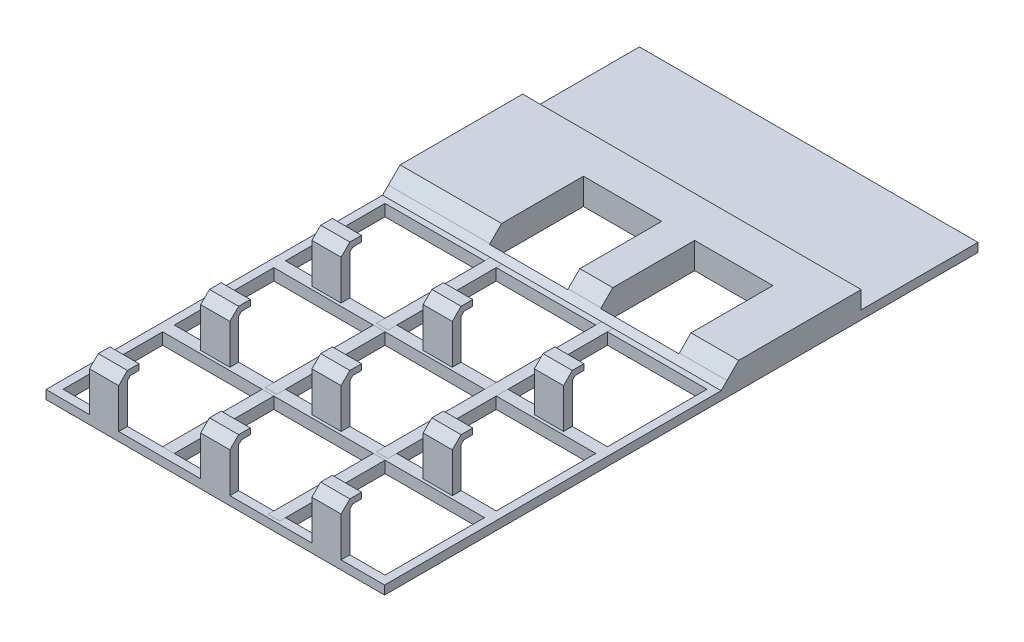
from build123d import *

# Parameters (mm, degrees)
SKETCH1_W             = 2
SKETCH1_H             = 57.15
EXTRUDE_THIN1_DEPTH   = 2
SKETCH1_W_2           = 59.15
SKETCH1_H_2           = 59.15
SKETCH1_W_3           = 55.15
SKETCH1_H_3           = 55.15
EXTRUDE_THIN1_2_DEPTH = 2
EXTRUDE_THIN1_3_DEPTH = 2
SKETCH1_W_4           = 57.15
SKETCH1_H_4           = 2
EXTRUDE_THIN1_4_DEPTH = 2
EXTRUDE_THIN1_5_DEPTH = 2
BOSS_EXTRUDE1_START   = 2
SKETCH2_W             = 5
SKETCH2_H             = 1.5
BOSS_EXTRUDE1_DEPTH   = 7.3
BOSS_EXTRUDE2_START   = 9.3
SKETCH3_W             = 5
SKETCH3_H             = 3.5
BOSS_EXTRUDE2_DEPTH   = 1
CHAMFER1_SIZE         = 0.5
CHAMFER2_SIZE         = 1.5
SKETCH4_W             = 58
SKETCH4_H             = 43
BOSS_EXTRUDE3_DEPTH   = 5
CHAMFER3_SIZE         = 2
SKETCH5_W             = 13.4
SKETCH5_H             = 16.1
CUT_EXTRUDE1_DEPTH    = 83.879038363
CHAMFER4_START        = -0.425
CHAMFER4_DEPTH        = 58.575
CHAMFER4_2_DEPTH      = 17.39
CHAMFER4_START_2      = 49.415
CHAMFER4_3_DEPTH      = 8.735
CHAMFER4_START_3      = 30.365
CHAMFER4_4_DEPTH      = 5.65
CUT_EXTRUDE2_START    = 5
SKETCH6_W             = 58
SKETCH6_H             = 20
CUT_EXTRUDE2_DEPTH    = 3
CUT_EXTRUDE3_DEPTH    = 83.879038363
CHAMFER5_SIZE         = 0.5


with BuildPart() as part:
    # Sketch1 → Extrude-Thin1 (new body)
    with BuildSketch(Plane(origin=(0, 0, 0), x_dir=(1, 0, 0), z_dir=(0, 1, 0))):
        with Locations((38.1, -28.575)):
            Rectangle(SKETCH1_W, SKETCH1_H)
    extrude(amount=EXTRUDE_THIN1_DEPTH)


with BuildPart() as body_2:
    # Sketch1 → Extrude-Thin1 2 (new body)
    with BuildSketch(Plane(origin=(0, 0, 0), x_dir=(1, 0, 0), z_dir=(0, 1, 0))):
        with Locations((28.575, -28.575)):
            Rectangle(SKETCH1_W_2, SKETCH1_H_2)
        with Locations((28.575, -28.575)):
            Rectangle(SKETCH1_W_3, SKETCH1_H_3, mode=Mode.SUBTRACT)
    extrude(amount=EXTRUDE_THIN1_2_DEPTH)



with BuildPart() as body_3:
    # Sketch1 → Extrude-Thin1 3 (new body)
    with BuildSketch(Plane(origin=(0, 0, 0), x_dir=(1, 0, 0), z_dir=(0, 1, 0))):
        with Locations((19.05, -28.575)):
            Rectangle(SKETCH1_W, SKETCH1_H)
    extrude(amount=EXTRUDE_THIN1_3_DEPTH)


with BuildPart() as body_4:
    # Sketch1 → Extrude-Thin1 4 (new body)
    with BuildSketch(Plane(origin=(0, 0, 0), x_dir=(1, 0, 0), z_dir=(0, 1, 0))):
        with Locations((28.575, -38.1)):
            Rectangle(SKETCH1_W_4, SKETCH1_H_4)
    extrude(amount=EXTRUDE_THIN1_4_DEPTH)


with BuildPart() as body_5:
    # Sketch1 → Extrude-Thin1 5 (new body)
    with BuildSketch(Plane(origin=(0, 0, 0), x_dir=(1, 0, 0), z_dir=(0, 1, 0))):
        with Locations((28.575, -19.05)):
            Rectangle(SKETCH1_W_4, SKETCH1_H_4)
    extrude(amount=EXTRUDE_THIN1_5_DEPTH)


with BuildPart() as body_2_1:
    add(body_2.part)

    add(body_4.part)  # Boss-Extrude1 merges body 4

    add(body_5.part)  # Boss-Extrude1 merges body 5
    # Sketch2 → Boss-Extrude1 (add)
    with BuildSketch(Plane(origin=(0, 0, 0), x_dir=(1, 0, 0), z_dir=(0, 1, 0)).offset(BOSS_EXTRUDE1_START)):
        with Locations((28.575, -56.9)):
            Rectangle(SKETCH2_W, SKETCH2_H)
        with Locations((9.525, -56.9)):
            Rectangle(SKETCH2_W, SKETCH2_H)
        with Locations((47.625, -56.9)):
            Rectangle(SKETCH2_W, SKETCH2_H)
        with Locations((28.575, -37.85)):
            Rectangle(SKETCH2_W, SKETCH2_H)
        with Locations((47.625, -37.85)):
            Rectangle(SKETCH2_W, SKETCH2_H)
        with Locations((28.575, -18.8)):
            Rectangle(SKETCH2_W, SKETCH2_H)
        with Locations((47.625, -18.8)):
            Rectangle(SKETCH2_W, SKETCH2_H)
        with Locations((9.525, -37.85)):
            Rectangle(SKETCH2_W, SKETCH2_H)
        with Locations((9.525, -18.8)):
            Rectangle(SKETCH2_W, SKETCH2_H)
    extrude(amount=BOSS_EXTRUDE1_DEPTH)

    # Sketch3 → Boss-Extrude2 (add)
    with BuildSketch(Plane(origin=(0, 0, 0), x_dir=(1, 0, 0), z_dir=(0, 1, 0)).offset(BOSS_EXTRUDE2_START)):
        with Locations((28.575, -55.9)):
            Rectangle(SKETCH3_W, SKETCH3_H)
        with Locations((9.525, -55.9)):
            Rectangle(SKETCH3_W, SKETCH3_H)
        with Locations((47.625, -55.9)):
            Rectangle(SKETCH3_W, SKETCH3_H)
        with Locations((28.575, -36.85)):
            Rectangle(SKETCH3_W, SKETCH3_H)
        with Locations((47.625, -36.85)):
            Rectangle(SKETCH3_W, SKETCH3_H)
        with Locations((28.575, -17.8)):
            Rectangle(SKETCH3_W, SKETCH3_H)
        with Locations((47.625, -17.8)):
            Rectangle(SKETCH3_W, SKETCH3_H)
        with Locations((9.525, -36.85)):
            Rectangle(SKETCH3_W, SKETCH3_H)
        with Locations((9.525, -17.8)):
            Rectangle(SKETCH3_W, SKETCH3_H)
    extrude(amount=BOSS_EXTRUDE2_DEPTH)

    # Chamfer1
    chamfer1_edges = [body_2_1.edges().sort_by_distance(p)[0] for p in [
        (28.575, 9.3, 56.15),
        (47.625, 9.3, 56.15),
        (47.625, 9.3, 37.1),
        (28.575, 9.3, 18.05),
        (47.625, 9.3, 18.05),
        (9.525, 9.3, 37.1),
        (28.575, 9.3, 37.1),
        (9.525, 9.3, 18.05),
        (9.525, 9.3, 56.15),
    ]]
    chamfer(chamfer1_edges, length=CHAMFER1_SIZE)

    # Chamfer2
    chamfer2_edges = [body_2_1.edges().sort_by_distance(p)[0] for p in [
        (28.575, 10.3, 57.65),
        (47.625, 10.3, 57.65),
        (28.575, 10.3, 38.6),
        (47.625, 10.3, 38.6),
        (28.575, 10.3, 19.55),
        (47.625, 10.3, 19.55),
        (9.525, 10.3, 38.6),
        (9.525, 10.3, 19.55),
        (9.525, 10.3, 57.65),
    ]]
    chamfer(chamfer2_edges, length=CHAMFER2_SIZE)

    # Sketch4 → Boss-Extrude3 (add)
    with BuildSketch(Plane(origin=(0, 0, 0), x_dir=(1, 0, 0), z_dir=(0, 1, 0))):
        with Locations((28.575, 22.5)):
            Rectangle(SKETCH4_W, SKETCH4_H)
    extrude(amount=BOSS_EXTRUDE3_DEPTH)

    # Chamfer3
    chamfer3_edges = [body_2_1.edges().sort_by_distance(p)[0] for p in [
        (28.575, 5, -1),
    ]]
    chamfer(chamfer3_edges, length=CHAMFER3_SIZE)

    # Sketch5 → Cut-Extrude1 (cut, through all)
    with BuildSketch(Plane(origin=(0, 0, 0), x_dir=(1, 0, 0), z_dir=(0, 1, 0))):
        with Locations((23.665, 8.977)):
            Rectangle(SKETCH5_W, SKETCH5_H)
        with Locations((42.715, 8.977)):
            Rectangle(SKETCH5_W, SKETCH5_H)
    extrude(amount=CUT_EXTRUDE1_DEPTH, mode=Mode.SUBTRACT)

    # Chamfer4: read off the stored shape, not the designer's step
    # Chamfer4 outline → Chamfer4 (add)
    with BuildSketch(Plane.YZ.offset(CHAMFER4_START)):
        Polygon((2, -0.927), (2.927, -0.927), (2, 0), align=None)
    extrude(amount=CHAMFER4_DEPTH)

    # Chamfer4 2 outline → Chamfer4 2 (add)
    with BuildSketch(Plane.YZ.offset(CHAMFER4_START)):
        Polygon((2, -1), (3, -1), (2.927, -0.927), (2, -0.927), align=None)
    extrude(amount=CHAMFER4_2_DEPTH)

    # Chamfer4 3 outline → Chamfer4 3 (add)
    with BuildSketch(Plane.YZ.offset(CHAMFER4_START_2)):
        Polygon((2, -1), (3, -1), (2.927, -0.927), (2, -0.927), align=None)
    extrude(amount=CHAMFER4_3_DEPTH)

    # Chamfer4 4 outline → Chamfer4 4 (add)
    with BuildSketch(Plane.YZ.offset(CHAMFER4_START_3)):
        Polygon((2, -1), (3, -1), (2.927, -0.927), (2, -0.927), align=None)
    extrude(amount=CHAMFER4_4_DEPTH)

    # Sketch6 → Cut-Extrude2 (cut)
    with BuildSketch(Plane(origin=(0, 0, 0), x_dir=(1, 0, 0), z_dir=(0, 1, 0)).offset(CUT_EXTRUDE2_START)):
        with Locations((28.575, 34)):
            Rectangle(SKETCH6_W, SKETCH6_H)
    extrude(amount=-CUT_EXTRUDE2_DEPTH, mode=Mode.SUBTRACT)

    # Sketch7 → Cut-Extrude3 (cut, through all)
    with BuildSketch(Plane(origin=(0, 0, 0), x_dir=(1, 0, 0), z_dir=(0, 1, 0))):
        Polygon((57.575, 1), (58.15, 1), (58.15, 0), (58.15, -58.15), (-1, -58.15), (-1, 1), (-0.425, 1), (-0.425, -57.65), (57.575, -57.65), align=None)
    extrude(amount=CUT_EXTRUDE3_DEPTH, mode=Mode.SUBTRACT)

    # Chamfer5
    chamfer5_edges = [body_2_1.edges().sort_by_distance(p)[0] for p in [
        (-0.425, 0, 6.825),
        (57.575, 0, 6.825),
        (28.575, 0, -44),
        (23.665, 0, -0.927),
        (23.665, 0, -17.027),
        (16.965, 0, -8.977),
        (30.365, 0, -8.977),
        (42.715, 0, -0.927),
        (42.715, 0, -17.027),
        (36.015, 0, -8.977),
        (49.415, 0, -8.977),
        (28.575, 0, 57.65),
    ]]
    chamfer(chamfer5_edges, length=CHAMFER5_SIZE)


solid = Compound([part.part, body_3.part, body_2_1.part])
